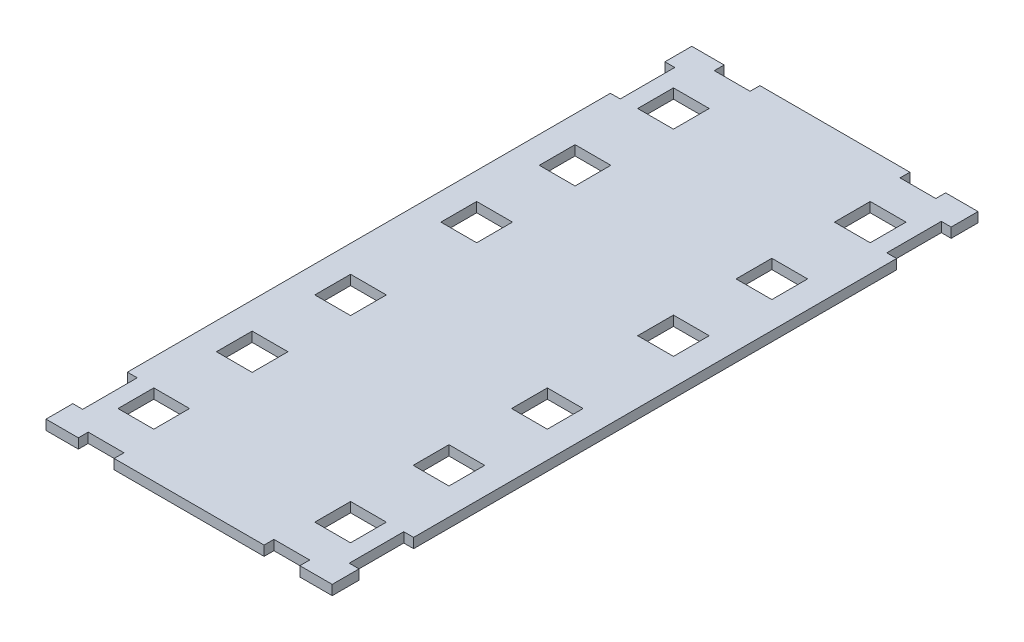
from build123d import *

# Parameters (mm, degrees)
SALIENTE_EXTRUIR1_DEPTH = 5.5
CROQUIS4_W              = 20
CROQUIS4_H              = 20
CORTAR_EXTRUIR3_DEPTH   = 10


with BuildPart() as part:
    # Croquis2 → Saliente-Extruir1 (new body)
    with BuildSketch(Plane(origin=(0, 0, 0), x_dir=(1, 0, 0), z_dir=(0, 1, 0))):
        Polygon((80, 321), (61.914280294, 321), (61.914280294, 315.5), (41.914280294, 315.5), (41.914280294, 321), (0, 321), (0, 140.5), (80, 140.5), (80, 275.5), (74.5, 275.5), (74.5, 306), (80, 306), align=None)
    extrude(amount=SALIENTE_EXTRUIR1_DEPTH)

    # Croquis4 → Cortar-Extruir3 (cut)
    with BuildSketch(Plane(origin=(0, 0, 0), x_dir=(1, 0, 0), z_dir=(0, 1, 0))):
        with Locations((55, 285.75)):
            Rectangle(CROQUIS4_W, CROQUIS4_H)
        with Locations((55, 230.75)):
            Rectangle(CROQUIS4_W, CROQUIS4_H)
        with Locations((55, 175.75)):
            Rectangle(CROQUIS4_W, CROQUIS4_H)
    extrude(amount=CORTAR_EXTRUIR3_DEPTH, mode=Mode.SUBTRACT)

    # Simetría3: part across plane


with BuildPart() as part_1:
    add(part.part)
    add(part.part.mirror(Plane(origin=(0, 5.5, 0), x_dir=(0, 0, 1), z_dir=(-1, 0, 0))))

    # Simetría4: part across plane


with BuildPart() as part_2:
    add(part_1.part)
    add(part_1.part.mirror(Plane(origin=(0, 5.5, -140.5), x_dir=(1, 0, 0), z_dir=(0, 0, -1))))


solid = part_2.part
